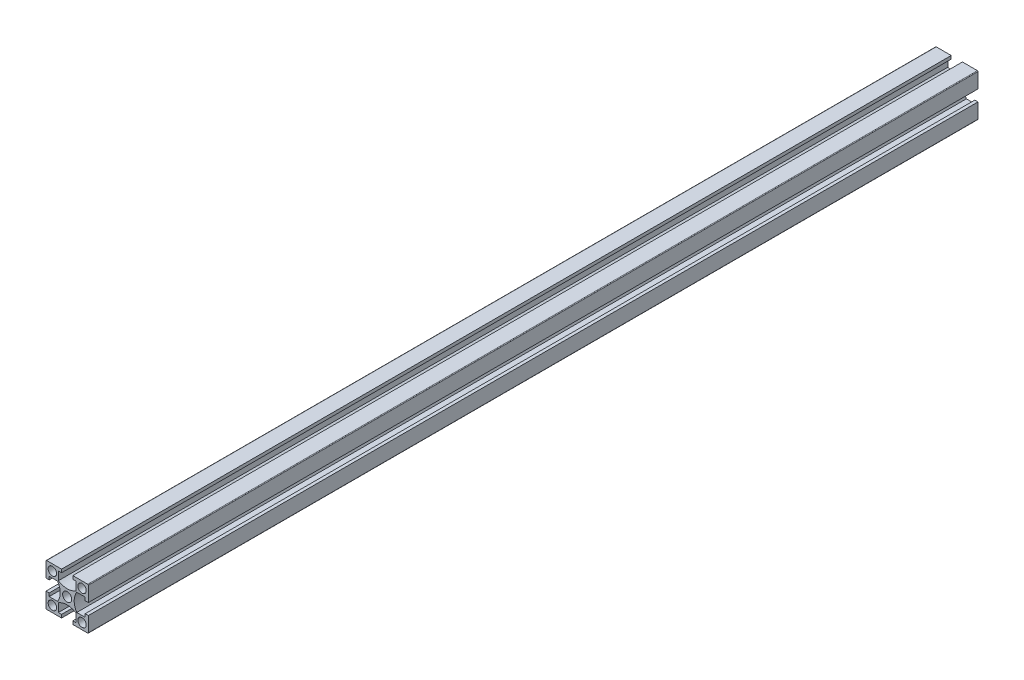
from build123d import *

# Parameters (mm, degrees)
SKETCH_1_W               = 20
SKETCH_1_H               = 20
SKETCH_1_R               = 2
SKETCH_1_R_2             = 2.15
EXTRUDE_1_DEPTH          = 420
CUT_EXTRUDE_1_REACH      = 422.238
PATTERN_CIRCULAR_1_COUNT = 4
FILLET_1_R               = 0.3
SKETCH_4_R               = 2.5
CUT_EXTRUDE_2_DEPTH      = 421.594816896
SKETCH_5_R               = 2.5
CUT_EXTRUDE_3_DEPTH      = 421.594816996
SKETCH_6_R               = 2.5
CUT_EXTRUDE_4_DEPTH      = 421.594816996
SKETCH_7_R               = 2.5
CUT_EXTRUDE_5_DEPTH      = 421.594816996


with BuildPart() as part:
    # 스케치1 → 보스-돌출1 (new body)
    with BuildSketch(Plane.XY):
        Rectangle(SKETCH_1_W, SKETCH_1_H)
        with Locations((-7, -7)):
            Circle(SKETCH_1_R, mode=Mode.SUBTRACT)
        with Locations((7, -7)):
            Circle(SKETCH_1_R, mode=Mode.SUBTRACT)
        with Locations((-7, 7)):
            Circle(SKETCH_1_R, mode=Mode.SUBTRACT)
        Circle(SKETCH_1_R_2, mode=Mode.SUBTRACT)
        with Locations((7, 7)):
            Circle(SKETCH_1_R, mode=Mode.SUBTRACT)
    extrude(amount=EXTRUDE_1_DEPTH)

    # 스케치1<3> → 컷-돌출1 (cut, up to next)
    with BuildSketch(Plane.XY, mode=Mode.PRIVATE) as cut_extrude_1_sk1:
        with BuildLine():
            Line((-8.5, 2.65), (-10, 2.65))
            Line((-10, 2.65), (-10, -2.65))
            Line((-10, -2.65), (-8.5, -2.65))
            Line((-8.5, -2.65), (-8.5, -4.15))
            Line((-8.5, -4.15), (-4.503166667, -4.15))
            ThreePointArc((-4.503166667, -4.15), (-3.3, 0), (-4.503166667, 4.15))
            Line((-4.503166667, 4.15), (-8.5, 4.15))
            Line((-8.5, 4.15), (-8.5, 2.65))
        make_face()
    cut_extrude_1_tool1 = extrude(cut_extrude_1_sk1.sketch, amount=CUT_EXTRUDE_1_REACH, mode=Mode.PRIVATE) & part.part
    cut_extrude_1 = cut_extrude_1_tool1.solids().sort_by_distance((-6.606913, 0, 0))[0]
    add(cut_extrude_1, mode=Mode.SUBTRACT)

    # 원형 패턴1: 컷-돌출1 ×4 about axis
    pattern_circular_1_axis = Axis((0, 0, 420), (0, 0, -1))
    for i in range(1, PATTERN_CIRCULAR_1_COUNT):
        add(cut_extrude_1.rotate(pattern_circular_1_axis, i * 360 / PATTERN_CIRCULAR_1_COUNT), mode=Mode.SUBTRACT)

    # 필렛1
    fillet_1_edges = [part.edges().sort_by_distance(p)[0] for p in [
        (10, -10, 210),
        (-10, -10, 210),
        (-10, 10, 210),
        (10, 10, 210),
    ]]
    fillet(fillet_1_edges, radius=FILLET_1_R)

    # 스케치4 → 컷-돌출2 (cut, through all)
    with BuildSketch(Plane(origin=(0, 10, 0), x_dir=(1, 0, 0), z_dir=(0, 1, 0))):
        with Locations((0, -11)):
            Circle(SKETCH_4_R)
        with Locations((0, -409)):
            Circle(SKETCH_4_R)
    extrude(amount=-CUT_EXTRUDE_2_DEPTH, mode=Mode.SUBTRACT)

    # 스케치5 → 컷-돌출3 (cut, through all)
    with BuildSketch(Plane.ZY.offset(10)):
        with Locations((131, 0)):
            Circle(SKETCH_5_R)
        with Locations((289, 0)):
            Circle(SKETCH_5_R)
    extrude(amount=-CUT_EXTRUDE_3_DEPTH, mode=Mode.SUBTRACT)

    # 스케치6 → 컷-돌출4 (cut, through all)
    with BuildSketch(Plane(origin=(0, 10, 0), x_dir=(1, 0, 0), z_dir=(0, 1, 0))):
        with Locations((0, -110)):
            Circle(SKETCH_6_R)
        with Locations((0, -310)):
            Circle(SKETCH_6_R)
    extrude(amount=-CUT_EXTRUDE_4_DEPTH, mode=Mode.SUBTRACT)

    # 스케치7 → 컷-돌출5 (cut, through all)
    with BuildSketch(Plane.XZ.offset(10)):
        with Locations((0, 249.5)):
            Circle(SKETCH_7_R)
        with Locations((0, 170.5)):
            Circle(SKETCH_7_R)
    extrude(amount=-CUT_EXTRUDE_5_DEPTH, mode=Mode.SUBTRACT)


solid = part.part
